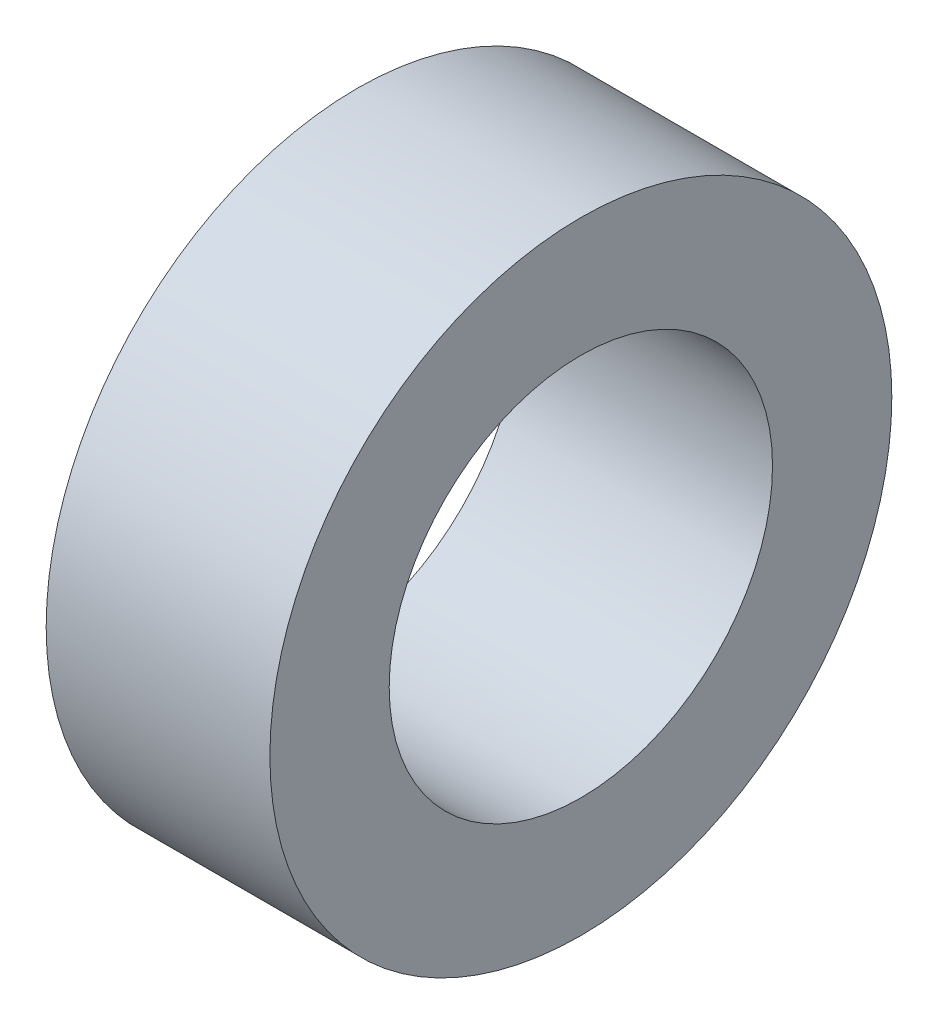
from build123d import *

# Parameters (mm, degrees)
SKETCH1_R           = 11.901099896
SKETCH1_R_2         = 10.2
BOSS_EXTRUDE1_DEPTH = 13.550000078
BOSS_EXTRUDE2_START = -11.90625
SKETCH2_R           = 16.55
SKETCH2_R_2         = 10.2
BOSS_EXTRUDE2_DEPTH = 11.90625


with BuildPart() as part:
    # Sketch1 → Boss-Extrude1 (new body)
    with BuildSketch(Plane(origin=(0, 0, 0), x_dir=(0, 0, -1), z_dir=(1, 0, 0))):
        Circle(SKETCH1_R)
        Circle(SKETCH1_R_2, mode=Mode.SUBTRACT)
    extrude(amount=BOSS_EXTRUDE1_DEPTH)

    # Sketch2 → Boss-Extrude2 (add)
    with BuildSketch(Plane(origin=(13.550000078, 0, 0), x_dir=(0, 0, -1), z_dir=(1, 0, 0)).offset(BOSS_EXTRUDE2_START)):
        Circle(SKETCH2_R)
        Circle(SKETCH2_R_2, mode=Mode.SUBTRACT)
    extrude(amount=BOSS_EXTRUDE2_DEPTH)


solid = part.part
